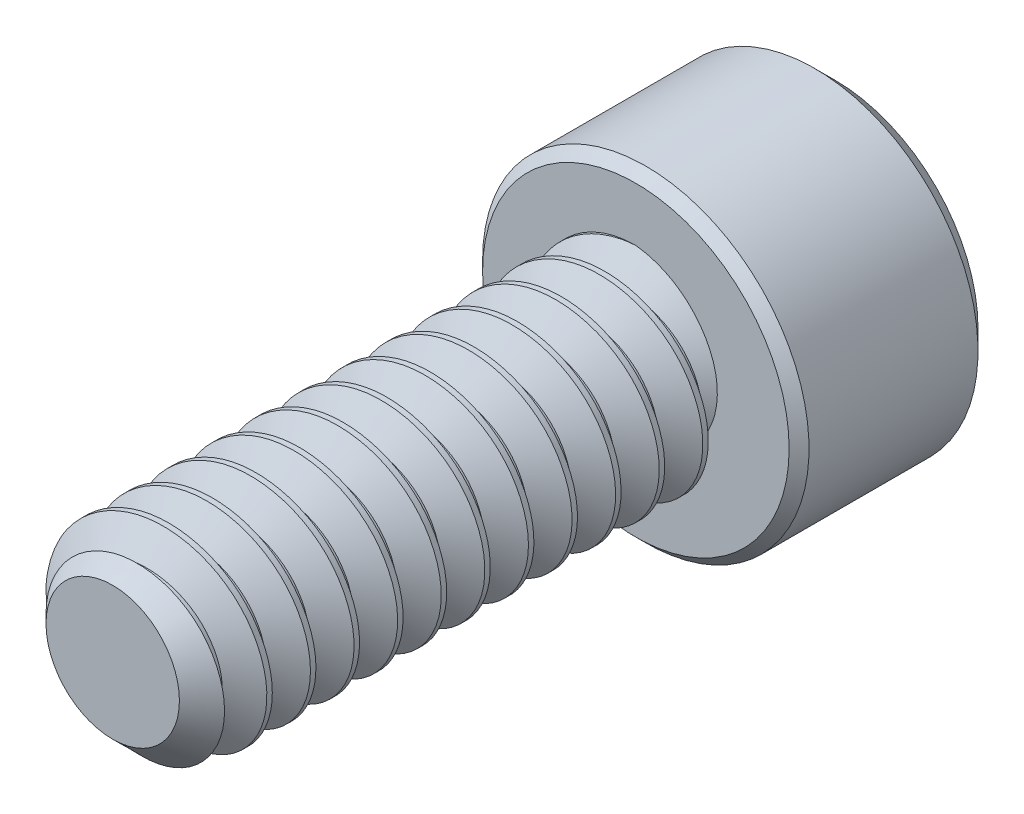
from build123d import *

# Parameters (mm, degrees)
SKETCH1_R          = 2.413
EXTRUDE1_DEPTH     = 12.7
CHAMFER3_SIZE      = 0.79375
CUT_SWEEP1_PITCH   = 1.058333333
SKETCH6_R          = 3.9624
EXTRUDE2_DEPTH     = 4.826
CUT_EXTRUDE1_DEPTH = 2.9765625
SKETCH8_R          = 2.291358881
CUT_EXTRUDE2_DEPTH = 0.4826
CUT_EXTRUDE2_DRAFT = -45
CHAMFER1_SIZE      = 0.4826
CHAMFER2_SIZE      = 0.2413


with BuildPart() as part:
    # Sketch1 → Extrude1 (new body)
    with BuildSketch(Plane.XY):
        Circle(SKETCH1_R)
    extrude(amount=-EXTRUDE1_DEPTH)

    # Chamfer3
    chamfer3_edges = [part.edges().sort_by_distance(p)[0] for p in [
        (-2.413, 0, 0),
    ]]
    chamfer(chamfer3_edges, length=CHAMFER3_SIZE)

    # Cut-Sweep1: the profile of Sketch3 profile screwed along a right-hand helix of 13 turns, 6 arcs to a turn; built about Z, then put on its axis
    cut_sweep1_z = Axis((0, 0, 0), (0, 0, 1))
    cut_sweep1_corners = [(2.4133, 0, -0.926214872), (1.725592336, 0, -0.529166667), (1.725592336, 0, -0.396875), (2.4133, 0, 0.000173205)]
    with BuildLine(mode=Mode.PRIVATE) as cut_sweep1_profile:
        Line(cut_sweep1_corners[0], cut_sweep1_corners[1])
        Line(cut_sweep1_corners[1], cut_sweep1_corners[2])
        Line(cut_sweep1_corners[2], cut_sweep1_corners[3])
        Line(cut_sweep1_corners[3], cut_sweep1_corners[0])
    cut_sweep1_cap = Face(cut_sweep1_profile.wire())
    cut_sweep1_turn_angles = [0, 30, 60, 90, 120, 150, 180, 210, 240, 270, 300, 330, 360]
    cut_sweep1_turn_weights = [1, 0.8660254037844387, 1, 0.8660254037844387, 1, 0.8660254037844387, 1, 0.8660254037844387, 1, 0.8660254037844387, 1, 0.8660254037844387, 1]
    cut_sweep1_turn_rails = [Edge.make_bspline([Vector(p[0], p[1], 0).rotate(cut_sweep1_z, cut_sweep1_turn_angles[k]) / cut_sweep1_turn_weights[k] + Vector(0, 0, p[2] + CUT_SWEEP1_PITCH * cut_sweep1_turn_angles[k] / 360) for k in range(13)], [0, 0, 0, 1, 1, 2, 2, 3, 3, 4, 4, 5, 5, 6, 6, 6], 2, cut_sweep1_turn_weights) for p in cut_sweep1_corners]
    cut_sweep1_turn_sides = [Face.make_surface_from_curves(cut_sweep1_turn_rails[p[0]], cut_sweep1_turn_rails[p[1]]) for p in [(0, 1), (1, 2), (2, 3), (3, 0)]]
    cut_sweep1 = Plane(origin=(0, 0, 0), x_dir=(0, 1, 0), z_dir=(0, 0, -1)) * Solid(Shell([*[p.moved(Location((0, 0, CUT_SWEEP1_PITCH * i))) for i in range(13) for p in cut_sweep1_turn_sides], cut_sweep1_cap, cut_sweep1_cap.rotate(cut_sweep1_z, 4680).moved(Location((0, 0, CUT_SWEEP1_PITCH * 4680 / 360)))]))
    add(cut_sweep1, mode=Mode.SUBTRACT)

    # Sketch6 → Extrude2 (add)
    with BuildSketch(Plane(origin=(0, 0, -12.7), x_dir=(-1, 0, 0), z_dir=(0, 0, -1))):
        Circle(SKETCH6_R)
    extrude(amount=EXTRUDE2_DEPTH)

    # Sketch7 → Cut-Extrude1 (cut)
    with BuildSketch(Plane(origin=(0, 0, -17.526), x_dir=(-1, 0, 0), z_dir=(0, 0, -1))):
        Polygon((0, 2.291358881), (-1.984375, 1.14567944), (-1.984375, -1.14567944), (0, -2.291358881), (1.984375, -1.14567944), (1.984375, 1.14567944), align=None)
    extrude(amount=-CUT_EXTRUDE1_DEPTH, mode=Mode.SUBTRACT)


with BuildPart() as cut_extrude2_tool:
    # Sketch8 → Cut-Extrude2 (with draft: the straight prism first)
    with BuildSketch(Plane(origin=(0, 0, -17.526), x_dir=(-1, 0, 0), z_dir=(0, 0, -1))):
        Circle(SKETCH8_R)
    extrude(amount=-CUT_EXTRUDE2_DEPTH)
    # Cut-Extrude2: the draft: its side faces are tilted about the plane it starts from
    cut_extrude2_sides = [cut_extrude2_tool.faces().sort_by_distance(p)[0] for p in [
        (2.291358881, 0, -17.2847),
    ]]
    draft(cut_extrude2_sides, Plane(origin=(0, 0, -17.526), x_dir=(-1, 0, 0), z_dir=(0, 0, -1)), CUT_EXTRUDE2_DRAFT)


with BuildPart() as part_1:
    add(part.part)

    # Cut-Extrude2: cut by cut_extrude2_tool
    add(cut_extrude2_tool.part, mode=Mode.SUBTRACT)

    # Chamfer1
    chamfer1_edges = [part_1.edges().sort_by_distance(p)[0] for p in [
        (3.9624, 0, -17.526),
    ]]
    chamfer(chamfer1_edges, length=CHAMFER1_SIZE)

    # Chamfer2
    chamfer2_edges = [part_1.edges().sort_by_distance(p)[0] for p in [
        (3.9624, 0, -12.7),
    ]]
    chamfer(chamfer2_edges, length=CHAMFER2_SIZE)


solid = part_1.part
